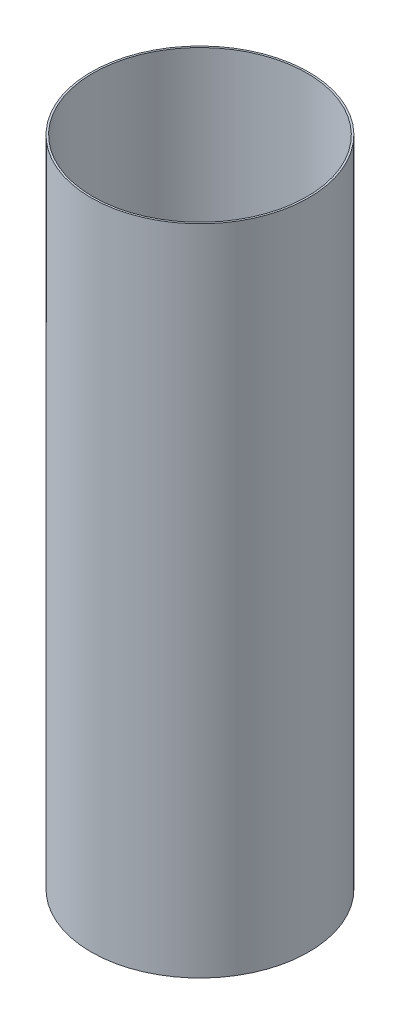
from build123d import *

# Parameters (mm, degrees)
SKETCH1_R           = 76.2
BOSS_EXTRUDE1_DEPTH = 457.2
SKETCH2_R           = 74.93
CUT_EXTRUDE1_DEPTH  = 470.728347026


with BuildPart() as part:
    # Sketch1 → Boss-Extrude1 (new body)
    with BuildSketch(Plane(origin=(0, 0, 0), x_dir=(1, 0, 0), z_dir=(0, 1, 0))):
        Circle(SKETCH1_R)
    extrude(amount=BOSS_EXTRUDE1_DEPTH)

    # Sketch2 → Cut-Extrude1 (cut, through all)
    with BuildSketch(Plane(origin=(0, 457.2, 0), x_dir=(1, 0, 0), z_dir=(0, 1, 0))):
        Circle(SKETCH2_R)
    extrude(amount=-CUT_EXTRUDE1_DEPTH, mode=Mode.SUBTRACT)


solid = part.part
